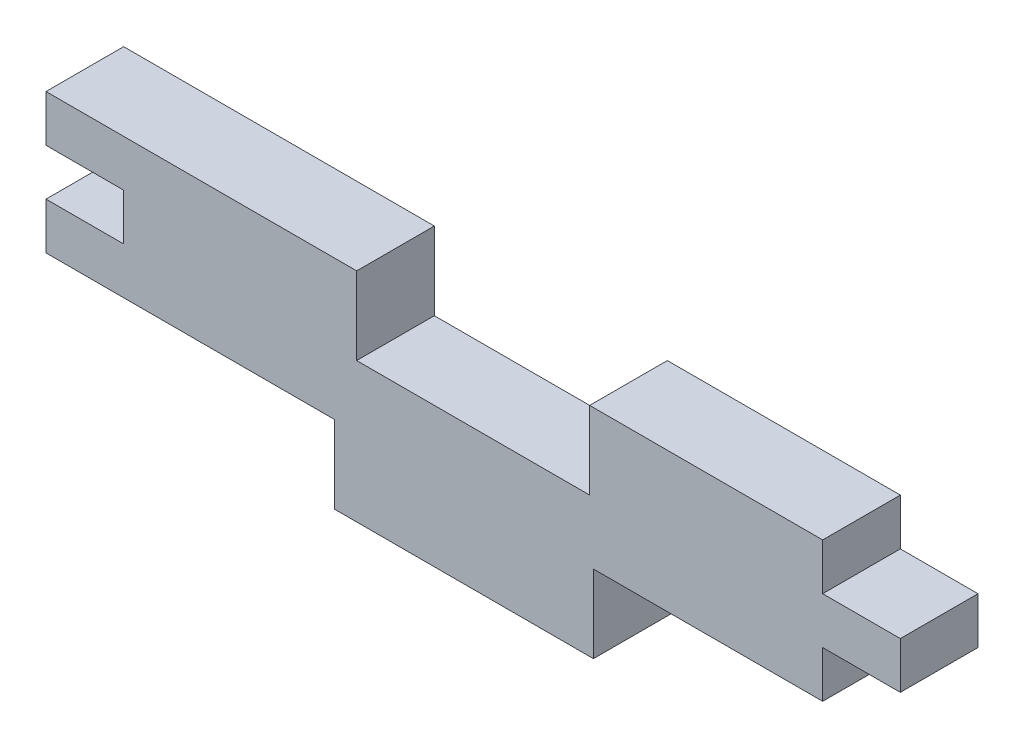
from build123d import *

# Parameters (mm, degrees)
BOSS_EXTRUDE1_DEPTH = 5
CAVITY1_START       = -0.5
CAVITY1_OUTLINE_W   = 15
CAVITY1_OUTLINE_H   = 5
CAVITY1_DEPTH       = 5


# Read off the part's stored shape, not the designer's step: Cavity1
with BuildPart() as part:
    # Sketch1 → Boss-Extrude1 (new body)
    with BuildSketch(Plane.XY):
        Polygon((25, 1.5), (25, 4.5), (-25, 4.5), (-25, 1.5), (-20, 1.5), (-20, -1.5), (-25, -1.5), (-25, -4.5), (-6.424137908, -4.5), (-6.424137908, -9.5), (10.242528759, -9.5), (10.242528759, -4.5), (25, -4.5), (25, -1.5), (30, -1.5), (30, 1.5), align=None)
    extrude(amount=BOSS_EXTRUDE1_DEPTH)

    # Cavity1 outline → Cavity1 (cut)
    with BuildSketch(Plane(origin=(0, 0, 0), x_dir=(1, 0, 0), z_dir=(0, 1, 0)).offset(CAVITY1_START)):
        with Locations((2.5, -2.5)):
            Rectangle(CAVITY1_OUTLINE_W, CAVITY1_OUTLINE_H)
    extrude(amount=CAVITY1_DEPTH, mode=Mode.SUBTRACT)


solid = part.part
